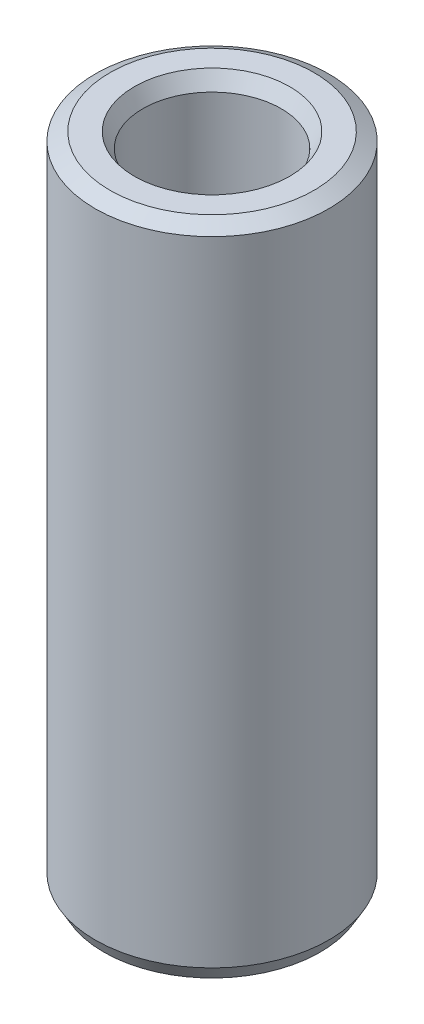
from build123d import *
from OCP.BRepFilletAPI import BRepFilletAPI_MakeChamfer

# Parameters (mm, degrees)
SKETCH1_R           = 37.5
BOSS_EXTRUDE1_DEPTH = 210.799337201
SKETCH2_R           = 22.202918022
CUT_EXTRUDE1_DEPTH  = 218.368030226
CHAMFER1_SIZE       = 2.739423504
CHAMFER1_SIZE2      = 4.744820693


with BuildPart() as part:
    # Sketch1 → Boss-Extrude1 (new body)
    with BuildSketch(Plane(origin=(0, 0, 0), x_dir=(1, 0, 0), z_dir=(0, 1, 0))):
        Circle(SKETCH1_R)
    extrude(amount=BOSS_EXTRUDE1_DEPTH)

    # Sketch2 → Cut-Extrude1 (cut, through all)
    with BuildSketch(Plane(origin=(0, 0, 0), x_dir=(1, 0, 0), z_dir=(0, 1, 0))):
        Circle(SKETCH2_R)
    extrude(amount=CUT_EXTRUDE1_DEPTH, mode=Mode.SUBTRACT)

    # Chamfer1: one chamfer whose edges measure the first distance from different faces: ONE call of the kernel's chamfer builder (chamfer() names one face for all edges)
    chamfer1_edges_1 = [part.edges().sort_by_distance(p)[0] for p in [
        (-22.202918022, 210.799337201, 0),
    ]]
    chamfer1_side_1 = [part.faces().sort_by_distance(p)[0] for p in [
        (-36.439339828, 210.799337201, 0),
    ]]
    chamfer1_edges_2 = [part.edges().sort_by_distance(p)[0] for p in [
        (-22.202918022, 0, 0),
    ]]
    chamfer1_side_2 = [part.faces().sort_by_distance(p)[0] for p in [
        (-22.202918022, 105.3996686, 0),
    ]]
    chamfer1_edges_3 = [part.edges().sort_by_distance(p)[0] for p in [
        (-37.5, 0, 0),
    ]]
    chamfer1_side_3 = [part.faces().sort_by_distance(p)[0] for p in [
        (-36.439339828, 0, 0),
    ]]
    chamfer1_edges_4 = [part.edges().sort_by_distance(p)[0] for p in [
        (-37.5, 210.799337201, 0),
    ]]
    chamfer1_side_4 = [part.faces().sort_by_distance(p)[0] for p in [
        (-37.5, 105.3996686, 0),
    ]]
    chamfer1 = BRepFilletAPI_MakeChamfer(part.part.solid().wrapped)
    for e in chamfer1_edges_1:
        chamfer1.Add(CHAMFER1_SIZE, CHAMFER1_SIZE2, e.wrapped, chamfer1_side_1[0].wrapped)  # the first distance lies on this face
    for e in chamfer1_edges_2:
        chamfer1.Add(CHAMFER1_SIZE, CHAMFER1_SIZE2, e.wrapped, chamfer1_side_2[0].wrapped)  # the first distance lies on this face
    for e in chamfer1_edges_3:
        chamfer1.Add(CHAMFER1_SIZE, CHAMFER1_SIZE2, e.wrapped, chamfer1_side_3[0].wrapped)  # the first distance lies on this face
    for e in chamfer1_edges_4:
        chamfer1.Add(CHAMFER1_SIZE, CHAMFER1_SIZE2, e.wrapped, chamfer1_side_4[0].wrapped)  # the first distance lies on this face
    add(Compound.cast(chamfer1.Shape()), mode=Mode.REPLACE)


solid = part.part
